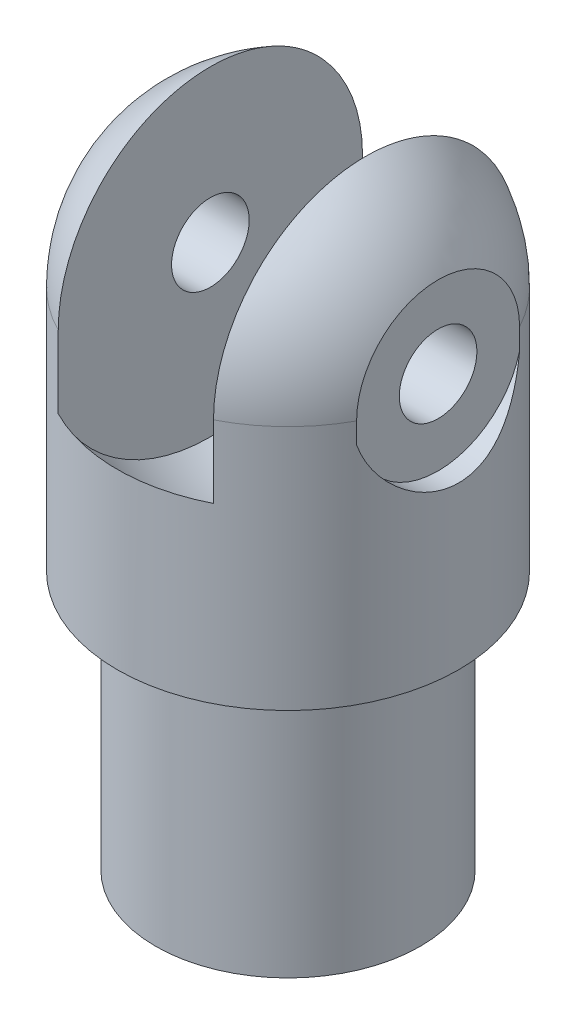
from build123d import *

# Parameters (mm, degrees)
SKETCH1_R               = 12.9921
BOSS_EXTRUDE1_DEPTH     = 25.4
CUT_EXTRUDE1_DEPTH      = 71.405666164
CUT_EXTRUDE1_DEPTH_BACK = 71.405666164
SKETCH3_R               = 3.81
SKETCH6_R               = 8.255
CUT_EXTRUDE2_DEPTH      = 2.032


with BuildPart() as part:
    # Sketch1 → Boss-Extrude1 (new body)
    with BuildSketch(Plane(origin=(0, 0, 0), x_dir=(1, 0, 0), z_dir=(0, 1, 0))):
        Circle(SKETCH1_R)
    extrude(amount=BOSS_EXTRUDE1_DEPTH)

    # Sketch2 → Revolve1 (revolve)
    with BuildSketch(Plane(origin=(0, 0, 0), x_dir=(0, 0, -1), z_dir=(1, 0, 0))):
        with BuildLine():
            Line((-16.764, 25.4), (-16.764, 49.53))
            ThreePointArc((-16.764, 49.53), (-11.85393808, 61.38393808), (0, 66.294))
            Line((0, 66.294), (0, 25.4))
            Line((0, 25.4), (-16.764, 25.4))
        make_face()
    revolve(axis=Axis((0, 25.4, 0), (0, 1, 0)))

    # Sketch3 → Cut-Extrude1 (cut, two sides: drawn at the far end of the back side and taken through both)
    with BuildSketch(Plane(origin=(0, 0, 0), x_dir=(0, 0, -1), z_dir=(1, 0, 0)).offset(-CUT_EXTRUDE1_DEPTH_BACK)):
        with Locations((0, 49.53)):
            Circle(SKETCH3_R)
    extrude(amount=CUT_EXTRUDE1_DEPTH + CUT_EXTRUDE1_DEPTH_BACK, mode=Mode.SUBTRACT)

    # Sketch4 → Cut-Revolve1 (revolve, cut)
    with BuildSketch(Plane.XY):
        with BuildLine():
            Line((-7.62, 32.995439638), (-7.62, 49.53))
            Line((-7.62, 49.53), (7.62, 49.53))
            Line((7.62, 49.53), (7.62, 32.995439638))
            ThreePointArc((7.62, 32.995439638), (0, 31.32406453), (-7.62, 32.995439638))
        make_face()
    revolve(axis=Axis((-7.62, 49.53, 0), (1, 0, 0)), mode=Mode.SUBTRACT)

    # Sketch6 → Cut-Extrude2 (cut)
    with BuildSketch(Plane(origin=(16.764, 0, 0), x_dir=(0, 0, -1), z_dir=(1, 0, 0))):
        with Locations((0, 49.53)):
            Circle(SKETCH6_R)
    cut_extrude2 = extrude(amount=-CUT_EXTRUDE2_DEPTH, mode=Mode.SUBTRACT)

    # Mirror1: Cut-Extrude2 across plane
    add(cut_extrude2.mirror(Plane(origin=(0, 0, 0), x_dir=(0, 0, 1), z_dir=(1, 0, 0))), mode=Mode.SUBTRACT)


solid = part.part
